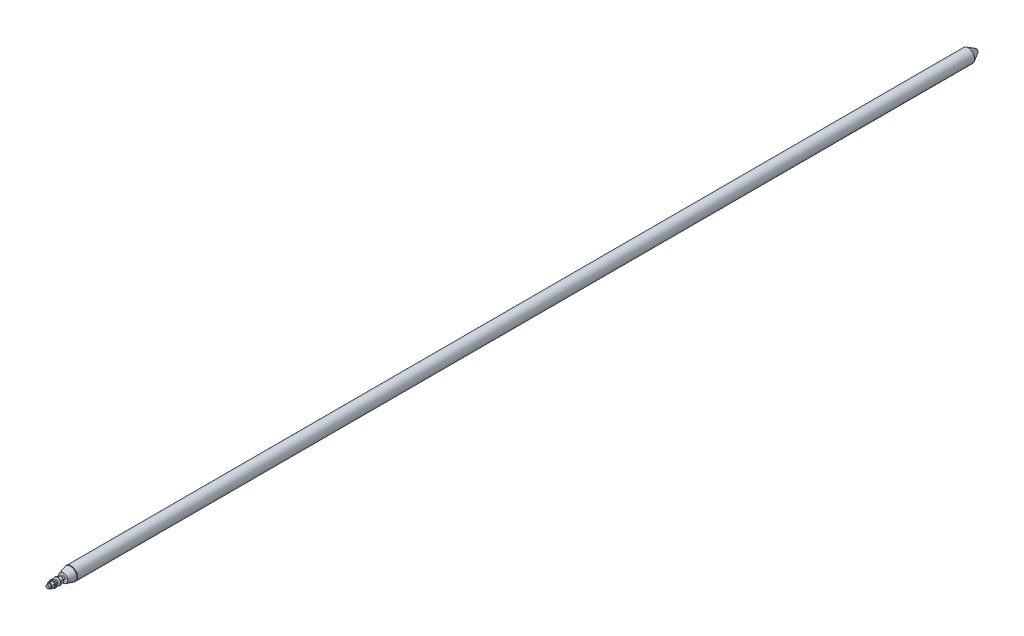
from build123d import *

# Parameters (mm, degrees)
BOSS_REVOLVE3_START         = 12.690475
BOSS_REVOLVE3_OUTLINE_R     = 7.9375
BOSS_REVOLVE3_DEPTH         = 15.478125
BOSS_REVOLVE3_START_2       = 46.292398399
BOSS_REVOLVE3_2_OUTLINE_R   = 16.6751
BOSS_REVOLVE3_2_OUTLINE_R_2 = 7.9375
BOSS_REVOLVE3_2_DEPTH       = 5.8166
BOSS_EXTRUDE2_DEPTH         = 13.890625


# Read off the part's stored shape, not the designer's step: Boss-Revolve3
with BuildPart() as part:
    # Sketch1 → Base-Revolve (revolve)
    with BuildSketch(Plane(origin=(0, 0, 0), x_dir=(0, 0, -1), z_dir=(1, 0, 0)), mode=Mode.PRIVATE) as base_revolve_sk:
        Polygon((-76.2, 0), (-76.2, 7.9375), (0, 7.9375), (0, 22.225), (34.895210283, 31.75), (38.1, 28.575), (47.625, 28.575), (47.625, 0), align=None)
    revolve(base_revolve_sk.sketch.rotate(Axis((0, 0, 0), (0, 0, 1)), 90), axis=Axis((0, 0, 0), (0, 0, 1)))

    # Sketch3 → Boss-Revolve2 (revolve)
    with BuildSketch(Plane(origin=(0, 0, 0), x_dir=(0, 0, -1), z_dir=(1, 0, 0)), mode=Mode.PRIVATE) as boss_revolve2_sk:
        with BuildLine():
            Line((-28.1686, 0), (-28.1686, 17.4625))
            Line((-28.1686, 17.4625), (-29.7688, 17.4625))
            ThreePointArc((-29.7688, 17.4625), (-33.309963658, 9.048473715), (-34.5186, 0))
            Line((-34.5186, 0), (-28.1686, 0))
        make_face()
    revolve(boss_revolve2_sk.sketch.rotate(Axis((0, 0, 0), (0, 0, 1)), 90), axis=Axis((0, 0, 0), (0, 0, 1)))

    # Sketch2 → Boss-Revolve1 (revolve)
    with BuildSketch(Plane(origin=(0, 0, 0), x_dir=(0, 0, -1), z_dir=(1, 0, 0)), mode=Mode.PRIVATE) as boss_revolve1_sk:
        with BuildLine():
            Line((38.1, 31.75), (38.1, 28.5623))
            Line((38.1, 28.5623), (4408.674792498, 28.5623))
            Line((4408.674792498, 28.5623), (4408.674792498, 0))
            Line((4408.674792498, 0), (4450.967405638, 0))
            ThreePointArc((4450.967405638, 0), (4449.265928266, 6.35), (4444.617405638, 10.998522628))
            Line((4444.617405638, 10.998522628), (4408.674792498, 31.75))
            Line((4408.674792498, 31.75), (38.1, 31.75))
        make_face()
    revolve(boss_revolve1_sk.sketch.rotate(Axis((0, 0, 29.7434), (0, 0, -1)), 90), axis=Axis((0, 0, 29.7434), (0, 0, -1)))

    # Boss-Revolve3 outline → Boss-Revolve3 (add)
    with BuildSketch(Plane.XY.offset(BOSS_REVOLVE3_START)):
        Polygon((0, -15.588572738), (13.5001, -7.794286369), (13.5001, 7.794286369), (0, 15.588572738), (-13.5001, 7.794286369), (-13.5001, -7.794286369), align=None)
        Circle(BOSS_REVOLVE3_OUTLINE_R, mode=Mode.SUBTRACT)
    extrude(amount=BOSS_REVOLVE3_DEPTH)

    # Boss-Revolve3 2 outline → Boss-Revolve3 2 (add)
    with BuildSketch(Plane.XY.offset(BOSS_REVOLVE3_START_2)):
        Circle(BOSS_REVOLVE3_2_OUTLINE_R)
        Circle(BOSS_REVOLVE3_2_OUTLINE_R_2, mode=Mode.SUBTRACT)
    extrude(amount=BOSS_REVOLVE3_2_DEPTH)

    # Sketch6 → Boss-Extrude2 (add)
    with BuildSketch(Plane.XY.offset(52.108998399)):
        Polygon((0, -13.755485633), (11.9126, -6.877742817), (11.9126, 6.877742817), (0, 13.755485633), (-11.9126, 6.877742817), (-11.9126, -6.877742817), align=None)
    extrude(amount=BOSS_EXTRUDE2_DEPTH)


solid = part.part
